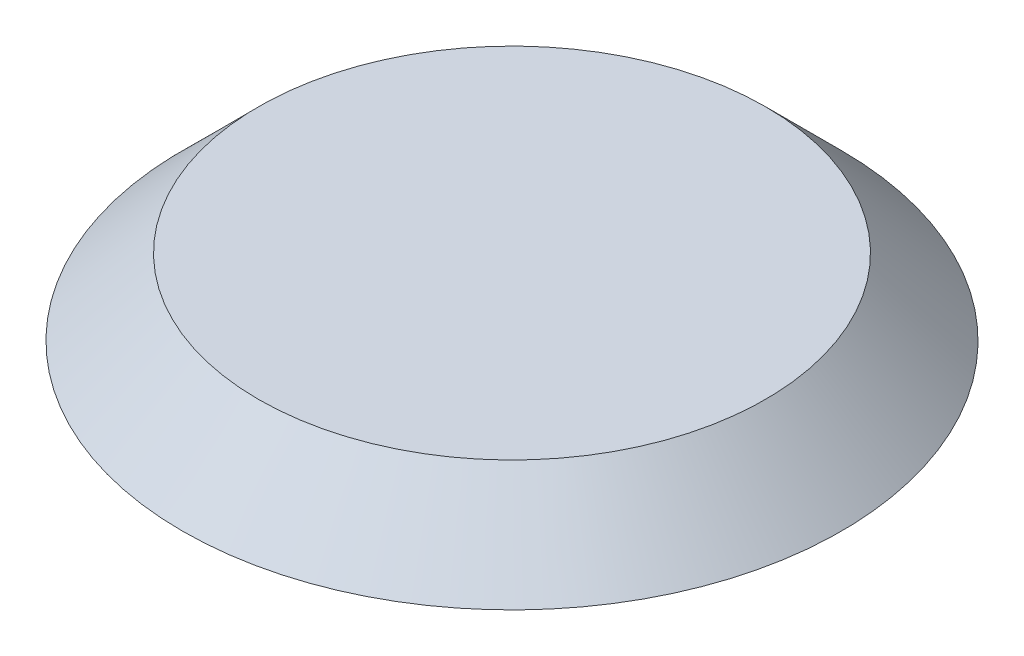
from build123d import *

# Parameters (mm, degrees)
ESQUISSE1_R        = 13
BOSS_EXTRU_3_DEPTH = 3
CHANFREIN2_SIZE    = 3


with BuildPart() as part:
    # Esquisse1 → Boss.-Extru.3 (new body)
    with BuildSketch(Plane(origin=(0, 0, 0), x_dir=(1, 0, 0), z_dir=(0, 1, 0))):
        with Locations(Location((0, 0, 0), (0, 0, 270))):
            Circle(ESQUISSE1_R)
    extrude(amount=BOSS_EXTRU_3_DEPTH)

    # Chanfrein2
    chanfrein2_edges = [part.edges().sort_by_distance(p)[0] for p in [
        (0, 3, -13),
    ]]
    chamfer(chanfrein2_edges, length=CHANFREIN2_SIZE - 0.0001)  # a hair under: the kernel refuses the full size


solid = part.part
